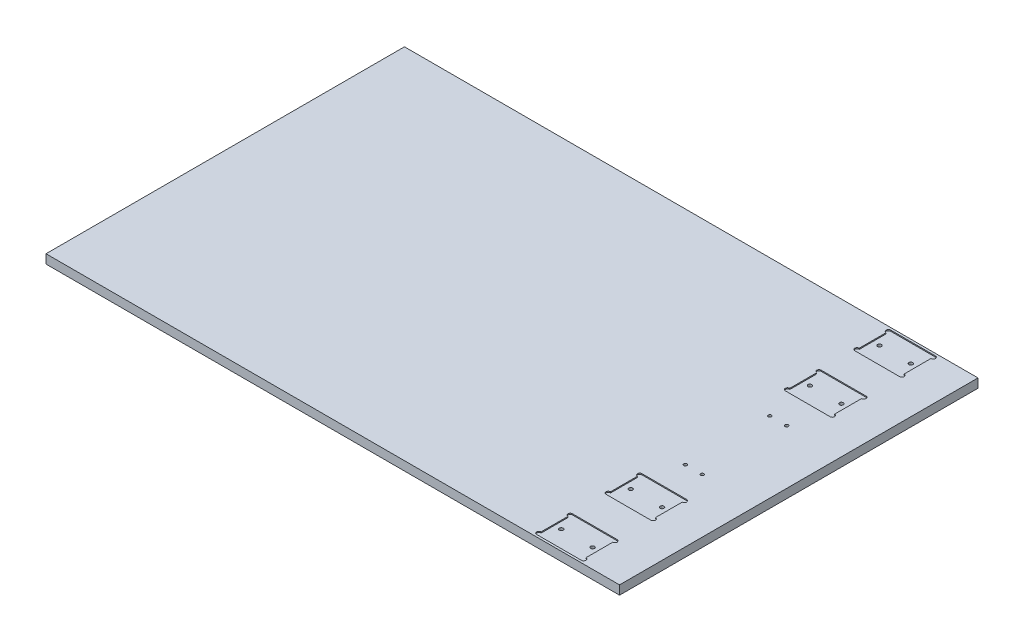
from build123d import *

# Parameters (mm, degrees)
SKETCH2_W           = 406.4
SKETCH2_H           = 6.35
BOSS_EXTRUDE1_DEPTH = 254
SKETCH3_R           = 1.3462
SKETCH3_R_2         = 1.1303
CUT_EXTRUDE1_DEPTH  = 480.288308328
CUT_EXTRUDE3_DEPTH  = 0.762


with BuildPart() as part:
    # Sketch2 → Boss-Extrude1 (new body)
    with BuildSketch(Plane.XY):
        with Locations((203.2, 3.175)):
            Rectangle(SKETCH2_W, SKETCH2_H)
    extrude(amount=-BOSS_EXTRUDE1_DEPTH)

    # Sketch3 → Cut-Extrude1 (cut, through all)
    with BuildSketch(Plane(origin=(0, 6.35, 0), x_dir=(1, 0, 0), z_dir=(0, 1, 0))):
        with Locations((350.8248, 239.7252)):
            Circle(SKETCH3_R)
        with Locations((373.0752, 239.7252)):
            Circle(SKETCH3_R)
        with Locations((373.0752, 190.5)):
            Circle(SKETCH3_R)
        with Locations((350.8248, 190.5)):
            Circle(SKETCH3_R)
        with Locations((355.9556, 156.9212)):
            Circle(SKETCH3_R_2)
        with Locations((367.9444, 156.9212)):
            Circle(SKETCH3_R_2)
        with Locations((367.9444, 97.0788)):
            Circle(SKETCH3_R_2)
        with Locations((355.9556, 97.0788)):
            Circle(SKETCH3_R_2)
        with Locations((373.0752, 63.5)):
            Circle(SKETCH3_R)
        with Locations((350.8248, 63.5)):
            Circle(SKETCH3_R)
        with Locations((350.8248, 14.2748)):
            Circle(SKETCH3_R)
        with Locations((373.0752, 14.2748)):
            Circle(SKETCH3_R)
    extrude(amount=-CUT_EXTRUDE1_DEPTH, mode=Mode.SUBTRACT)

    # Sketch4 → Cut-Extrude3 (cut)
    with BuildSketch(Plane(origin=(0, 6.35, 0), x_dir=(1, 0, 0), z_dir=(0, 1, 0))):
        with BuildLine():
            Line((346.075, 252.4252), (377.825, 252.4252))
            ThreePointArc((377.825, 252.4252), (379.4125, 250.8377), (377.825, 249.2502))
            Line((377.825, 249.2502), (377.825, 230.2002))
            ThreePointArc((377.825, 230.2002), (379.4125, 228.6127), (377.825, 227.0252))
            Line((377.825, 227.0252), (346.075, 227.0252))
            ThreePointArc((346.075, 227.0252), (344.4875, 228.6127), (346.075, 230.2002))
            Line((346.075, 230.2002), (346.075, 249.2502))
            ThreePointArc((346.075, 249.2502), (344.4875, 250.8377), (346.075, 252.4252))
        make_face()
        with BuildLine():
            Line((346.075, 203.2), (377.825, 203.2))
            ThreePointArc((377.825, 203.2), (379.4125, 201.6125), (377.825, 200.025))
            Line((377.825, 200.025), (377.825, 180.975))
            ThreePointArc((377.825, 180.975), (379.4125, 179.3875), (377.825, 177.8))
            Line((377.825, 177.8), (346.075, 177.8))
            ThreePointArc((346.075, 177.8), (344.4875, 179.3875), (346.075, 180.975))
            Line((346.075, 180.975), (346.075, 200.025))
            ThreePointArc((346.075, 200.025), (344.4875, 201.6125), (346.075, 203.2))
        make_face()
        with BuildLine():
            Line((346.075, 4.7498), (346.075, 23.7998))
            ThreePointArc((346.075, 23.7998), (344.4875, 25.3873), (346.075, 26.9748))
            Line((346.075, 26.9748), (377.825, 26.9748))
            ThreePointArc((377.825, 26.9748), (379.4125, 25.3873), (377.825, 23.7998))
            Line((377.825, 23.7998), (377.825, 4.7498))
            ThreePointArc((377.825, 4.7498), (379.4125, 3.1623), (377.825, 1.5748))
            Line((377.825, 1.5748), (346.075, 1.5748))
            ThreePointArc((346.075, 1.5748), (344.4875, 3.1623), (346.075, 4.7498))
        make_face()
        with BuildLine():
            Line((346.075, 53.975), (346.075, 73.025))
            ThreePointArc((346.075, 73.025), (344.4875, 74.6125), (346.075, 76.2))
            Line((346.075, 76.2), (377.825, 76.2))
            ThreePointArc((377.825, 76.2), (379.4125, 74.6125), (377.825, 73.025))
            Line((377.825, 73.025), (377.825, 53.975))
            ThreePointArc((377.825, 53.975), (379.4125, 52.3875), (377.825, 50.8))
            Line((377.825, 50.8), (346.075, 50.8))
            ThreePointArc((346.075, 50.8), (344.4875, 52.3875), (346.075, 53.975))
        make_face()
    extrude(amount=-CUT_EXTRUDE3_DEPTH, mode=Mode.SUBTRACT)


solid = part.part
